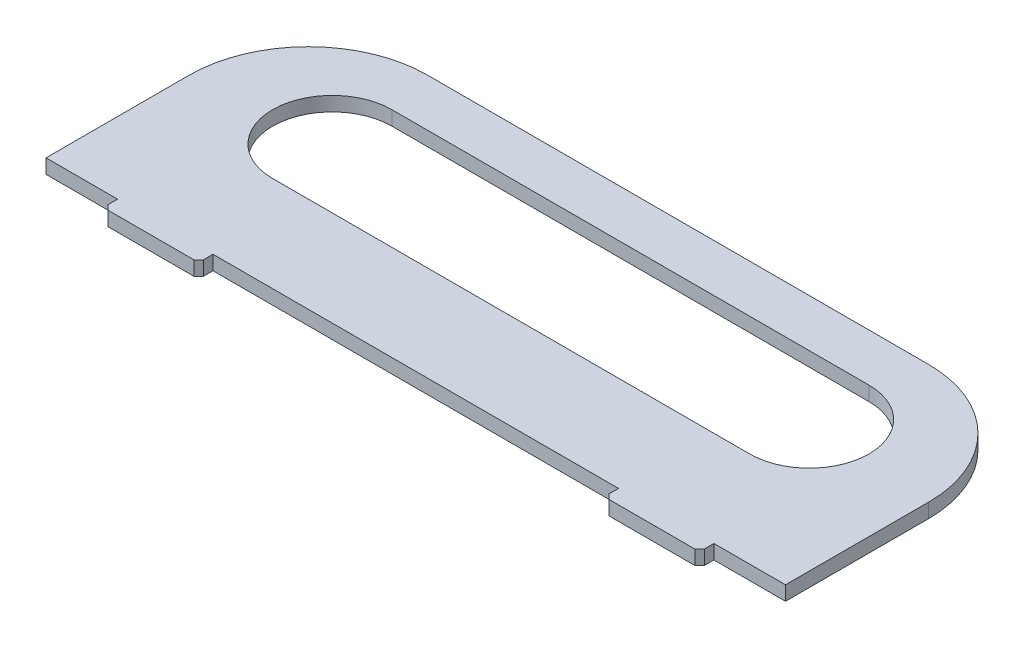
from build123d import *

# Parameters (mm, degrees)
SKETCH1_W               = 155
SKETCH1_H               = 55
EXTRUDE1_DEPTH          = 3
FILLET1_R               = 25
TAB_AND_SLOT_TAB1_DEPTH = 3


# Read off the part's stored shape, not the designer's step: Tab and Slot-Tab1
with BuildPart() as part:
    # Sketch1 → Extrude1 (new body)
    with BuildSketch(Plane(origin=(0, 0, 0), x_dir=(1, 0, 0), z_dir=(0, 1, 0))):
        Rectangle(SKETCH1_W, SKETCH1_H)
        with BuildLine():
            Line((-50, 17.5), (50, 17.5))
            ThreePointArc((50, 17.5), (62.5, 5), (50, -7.5))
            Line((50, -7.5), (-50, -7.5))
            ThreePointArc((-50, -7.5), (-62.5, 5), (-50, 17.5))
        make_face(mode=Mode.SUBTRACT)
    extrude(amount=EXTRUDE1_DEPTH)

    # Fillet1
    fillet1_edges = [part.edges().sort_by_distance(p)[0] for p in [
        (-77.5, 1.5, -27.5),
        (77.5, 1.5, -27.5),
    ]]
    fillet(fillet1_edges, radius=FILLET1_R)

    # Tab and Slot-Tab1 outline → Tab and Slot-Tab1 (add)
    with BuildSketch(Plane(origin=(0, 0, 0), x_dir=(1, 0, 0), z_dir=(0, 1, 0))):
        Polygon((62.5, -27.5), (42.5, -27.5), (42.5, -29.5), (43.5, -30.5), (61.5, -30.5), (62.5, -29.5), align=None)
        Polygon((-42.5, -29.5), (-42.5, -27.5), (-62.5, -27.5), (-62.5, -29.5), (-61.5, -30.5), (-43.5, -30.5), align=None)
    extrude(amount=TAB_AND_SLOT_TAB1_DEPTH)


solid = part.part
